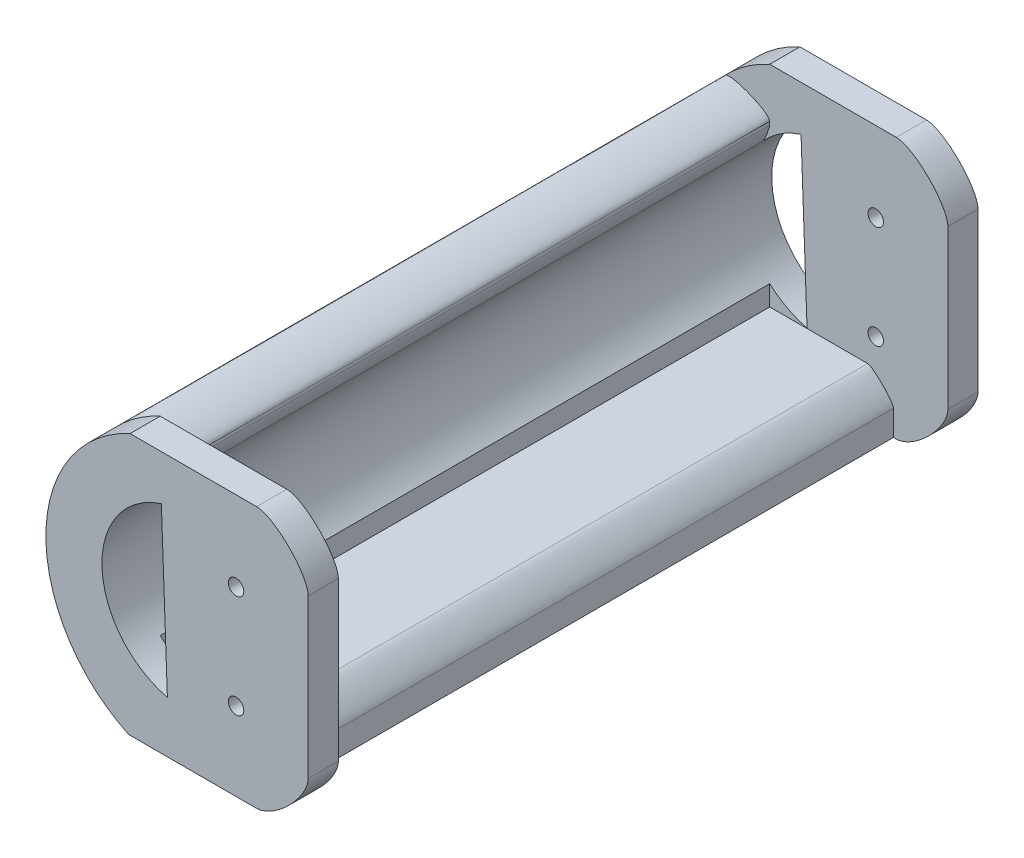
from build123d import *

# Parameters (mm, degrees)
BOSS_EXTRUDE1_DEPTH     = 130
CUT_EXTRUDE3_DEPTH      = 273.019096875
CUT_EXTRUDE3_DEPTH_BACK = 273.019096875
FILLET2_SIZE            = 10
CUT_EXTRUDE4_DEPTH      = 272.254010875
CUT_EXTRUDE4_DEPTH_BACK = 272.254010875
SKETCH8_R               = 1.5
SKETCH9_W               = 24.273397223
SKETCH9_H               = 9.918939499
BOSS_EXTRUDE5_DEPTH     = 129
FILLET5_SIZE            = 5


with BuildPart() as part:
    # Sketch1 → Boss-Extrude1 (new body)
    with BuildSketch(Plane.XY):
        with BuildLine():
            Line((-213.038141425, 15.471509733), (-219.113768434, 15.471509733))
            ThreePointArc((-219.113768434, 15.471509733), (-235.448907683, -9.805845818), (-219.370745969, -35.247429766))
            Line((-219.370745969, -35.247429766), (-184.542720563, -35.247429766))
            Line((-184.542720563, -35.247429766), (-184.542720563, -25.247429766))
            Line((-184.542720563, -25.247429766), (-211.872100418, -25.247429766))
            ThreePointArc((-211.872100418, -25.247429766), (-224.566556185, -9.701816168), (-213.038141425, 6.727151008))
            Line((-213.038141425, 6.727151008), (-184.542720563, 6.727151008))
            Line((-184.542720563, 6.727151008), (-184.542720563, 15.471509733))
            Line((-184.542720563, 15.471509733), (-213.038141425, 15.471509733))
        make_face()
    extrude(amount=BOSS_EXTRUDE1_DEPTH)

    # Sketch6 → Cut-Extrude3 (cut, two sides: drawn at the far end of the back side and taken through both)
    with BuildSketch(Plane(origin=(0, -25.247429766, 0), x_dir=(1, 0, 0), z_dir=(0, 1, 0)).offset(-CUT_EXTRUDE3_DEPTH_BACK)):
        Polygon((-184.285743028, -5.850012024), (-219.113768434, -5.85), (-219.113768434, -124.15), (-184.232404978, -124.15), align=None)
    extrude(amount=CUT_EXTRUDE3_DEPTH + CUT_EXTRUDE3_DEPTH_BACK, mode=Mode.SUBTRACT)

    # loft from a face of the part (loft4)
    loft([part.faces().sort_by_distance((-198.20741049, -25.247429766, 127.075))[0], part.faces().sort_by_distance((-198.790430994, 6.727151008, 127.075))[0]])

    # loft from a face of the part (loft5)
    loft([part.faces().sort_by_distance((-198.207406817, -25.247429766, 2.925003609))[0], part.faces().sort_by_distance((-198.790427001, 6.727151008, 2.925003508))[0]])

    # Fillet2
    # a fillet whose section is not a circle: 10 mm, written as the material it takes off along each edge
    with BuildSketch(Plane(origin=(-184.542720563, 15.471509733, 99.15), x_dir=(0, -1, 0), z_dir=(0, 0, 1))) as fillet2_piece_1:
        with BuildLine():
            Bezier((FILLET2_SIZE, 0), (0, 0), (0, -FILLET2_SIZE), weights=[1, 0.353553391, 1])
            Line((0, -FILLET2_SIZE), (0, 0))
            Line((0, 0), (FILLET2_SIZE, 0))
        make_face()
    extrude(amount=55.85, mode=Mode.SUBTRACT)
    with BuildSketch(Plane(origin=(-184.542720563, -35.247429766, 99.15), x_dir=(0, 1, 0), z_dir=(0, 0, 1))) as fillet2_piece_2:
        with BuildLine():
            Bezier((FILLET2_SIZE, 0), (0, 0), (0, FILLET2_SIZE), weights=[1, 0.353553391, 1])
            Line((0, FILLET2_SIZE), (0, 0))
            Line((0, 0), (FILLET2_SIZE, 0))
        make_face()
    extrude(amount=55.85, mode=Mode.SUBTRACT)
    with BuildSketch(Plane(origin=(-184.542720563, 15.471509733, -25), x_dir=(-1, 0, 0), z_dir=(0, 0, 1))) as fillet2_piece_3:
        with BuildLine():
            Bezier((FILLET2_SIZE, 0), (0, 0), (0, FILLET2_SIZE), weights=[1, 0.353553391, 1])
            Line((0, FILLET2_SIZE), (0, 0))
            Line((0, 0), (FILLET2_SIZE, 0))
        make_face()
    extrude(amount=55.850011936, mode=Mode.SUBTRACT)
    with BuildSketch(Plane(origin=(-184.542720563, -35.247429766, -25), x_dir=(-1, 0, 0), z_dir=(0, 0, 1))) as fillet2_piece_4:
        with BuildLine():
            Bezier((FILLET2_SIZE, 0), (0, 0), (0, -FILLET2_SIZE), weights=[1, 0.353553391, 1])
            Line((0, -FILLET2_SIZE), (0, 0))
            Line((0, 0), (FILLET2_SIZE, 0))
        make_face()
    extrude(amount=55.850011936, mode=Mode.SUBTRACT)

    # Sketch8 → Cut-Extrude4 (cut, two sides: drawn at the far end of the back side and taken through both)
    with BuildSketch(Plane.XY.offset(130).offset(-CUT_EXTRUDE4_DEPTH_BACK)):
        with Locations((-198.542720563, -0.028490267)):
            Circle(SKETCH8_R)
        with Locations((-198.542720563, -20.028490267)):
            Circle(SKETCH8_R)
    extrude(amount=CUT_EXTRUDE4_DEPTH + CUT_EXTRUDE4_DEPTH_BACK, mode=Mode.SUBTRACT)

    # Sketch9 → Boss-Extrude5 (add)
    with BuildSketch(Plane.XY.offset(130)):
        with Locations((-207.234047358, -30.287960017)):
            Rectangle(SKETCH9_W, SKETCH9_H)
    extrude(amount=-BOSS_EXTRUDE5_DEPTH)

    # Fillet5
    # a fillet whose section is not a circle: 5 mm, written as the material it takes off along each edge
    with BuildSketch(Plane(origin=(-219.113768434, 3.222415949, 124.15), x_dir=(-0.7039216353317727, -0.7102776438209518, 0), z_dir=(0, 0, -1))) as fillet5_piece_1_section:
        with BuildLine():
            Bezier((1.79521773, 0), (-0.103639657, 0.102712225), (-1.454327272, 1.441313042), weights=[1, 0.23367054, 1])
            Line((-1.454327272, 1.441313042), (0, 0))
            ThreePointArc((0, 0), (0.897608865, 0.024258816), (1.79521773, 0))
        make_face()
    fillet5_piece_1 = extrude(amount=123.418868953, mode=Mode.PRIVATE)
    fillet5_piece_1 = split(fillet5_piece_1, bisect_by=Plane(origin=(-219.113727591, 3.222415949, 5.85), z_dir=(-3.452476154533893e-07, 0, 0.9999999999999404)), keep=Keep.TOP, mode=Mode.PRIVATE)
    add(fillet5_piece_1, mode=Mode.SUBTRACT)
    with BuildSketch(Plane(origin=(-195.097348746, -25.328490267, 124.15), x_dir=(-1, 0, 0), z_dir=(0, 0, -1))) as fillet5_piece_2_section:
        with BuildLine():
            Bezier((FILLET5_SIZE, 0), (0, 0), (0, -FILLET5_SIZE), weights=[1, 0.176776695, 1])
            Line((0, -FILLET5_SIZE), (0, 0))
            Line((0, 0), (FILLET5_SIZE, 0))
        make_face()
    fillet5_piece_2 = extrude(amount=130.799991708, mode=Mode.PRIVATE)
    fillet5_piece_2 = split(fillet5_piece_2, bisect_by=Plane(origin=(-195.097307903, -25.328490267, 5.850008292), z_dir=(-3.452476154533893e-07, 0, 0.9999999999999404)), keep=Keep.TOP, mode=Mode.PRIVATE)
    add(fillet5_piece_2, mode=Mode.SUBTRACT)
    with BuildSketch(Plane(origin=(-219.113768434, 15.471509733, -20.605653446), x_dir=(0, -1, 0), z_dir=(0, 0, 1))) as fillet5_piece_3_section:
        with BuildLine():
            Bezier((9.588913957, 0), (-2.904204754, 0), (6.139263069, -8.619379609), weights=[1, 0.092891751, 1])
            ThreePointArc((6.139263069, -8.619379609), (2.657898383, -4.602951994), (0, 0))
            Line((0, 0), (9.588913957, 0))
        make_face()
    fillet5_piece_3 = extrude(amount=144.755653446, mode=Mode.PRIVATE)
    fillet5_piece_3 = split(fillet5_piece_3, bisect_by=Plane(origin=(-219.113777568, 15.471509733, 5.85), z_dir=(-3.452476154533893e-07, 0, 0.9999999999999404)), keep=Keep.TOP, mode=Mode.PRIVATE)
    add(fillet5_piece_3, mode=Mode.SUBTRACT)


solid = part.part
